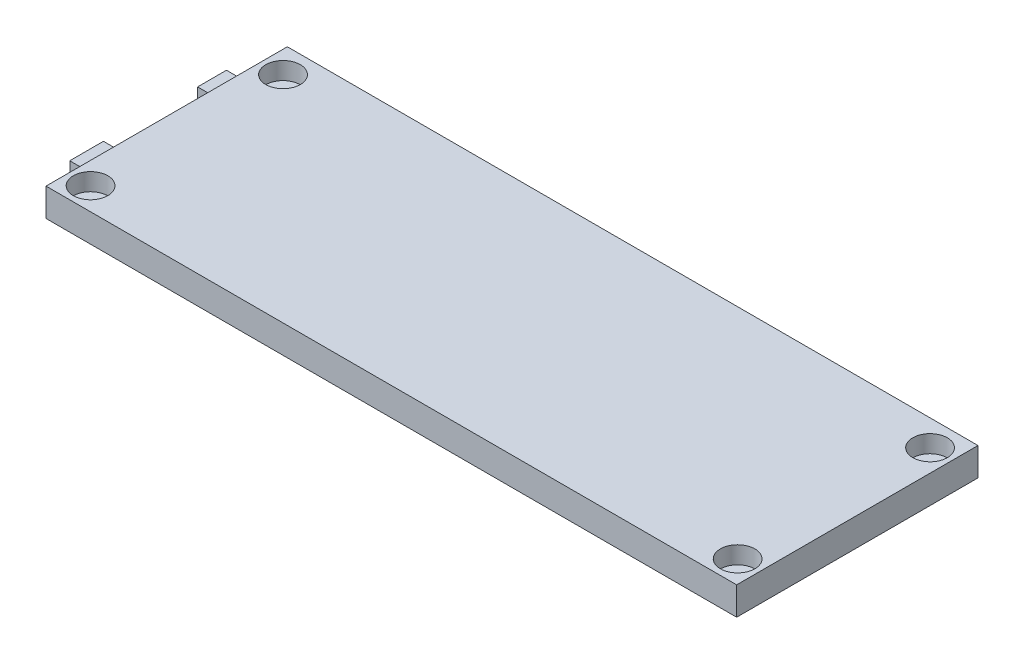
from build123d import *

# Parameters (mm, degrees)
SKETCH1_W           = 122.98346252
SKETCH1_H           = 42.97487903
BOSS_EXTRUDE1_DEPTH = 5
SKETCH3_R           = 3.075
CUT_EXTRUDE1_DEPTH  = 3.1
SKETCH5_W           = 5.142433448
SKETCH5_H           = 2
SKETCH5_W_2         = 6
SKETCH5_H_2         = 2.003550683
BOSS_EXTRUDE2_DEPTH = 3.1


with BuildPart() as part:
    # Sketch1 → Boss-Extrude1 (new body)
    with BuildSketch(Plane(origin=(0, 0, 0), x_dir=(1, 0, 0), z_dir=(0, 1, 0))):
        Rectangle(SKETCH1_W, SKETCH1_H)
    extrude(amount=BOSS_EXTRUDE1_DEPTH)

    # Sketch3 → Cut-Extrude1 (cut)
    with BuildSketch(Plane(origin=(0, 5, 0), x_dir=(1, 0, 0), z_dir=(0, 1, 0))):
        with Locations((-57.580191112, 16.807489546)):
            Circle(SKETCH3_R)
        with Locations((-57.580191112, -17.461046338)):
            Circle(SKETCH3_R)
        with Locations((57.567673953, 16.878323528)):
            Circle(SKETCH3_R)
        with Locations((57.567673953, -17.390212356)):
            Circle(SKETCH3_R)
    extrude(amount=-CUT_EXTRUDE1_DEPTH, mode=Mode.SUBTRACT)

    # Sketch5 → Boss-Extrude2 (add)
    with BuildSketch(Plane.ZY.offset(61.49173126)):
        with Locations((-11.176561417, 2.70029737)):
            Rectangle(SKETCH5_W, SKETCH5_H)
        with Locations((11.157157367, 2.691921307)):
            Rectangle(SKETCH5_W_2, SKETCH5_H_2)
    extrude(amount=BOSS_EXTRUDE2_DEPTH)


solid = part.part
